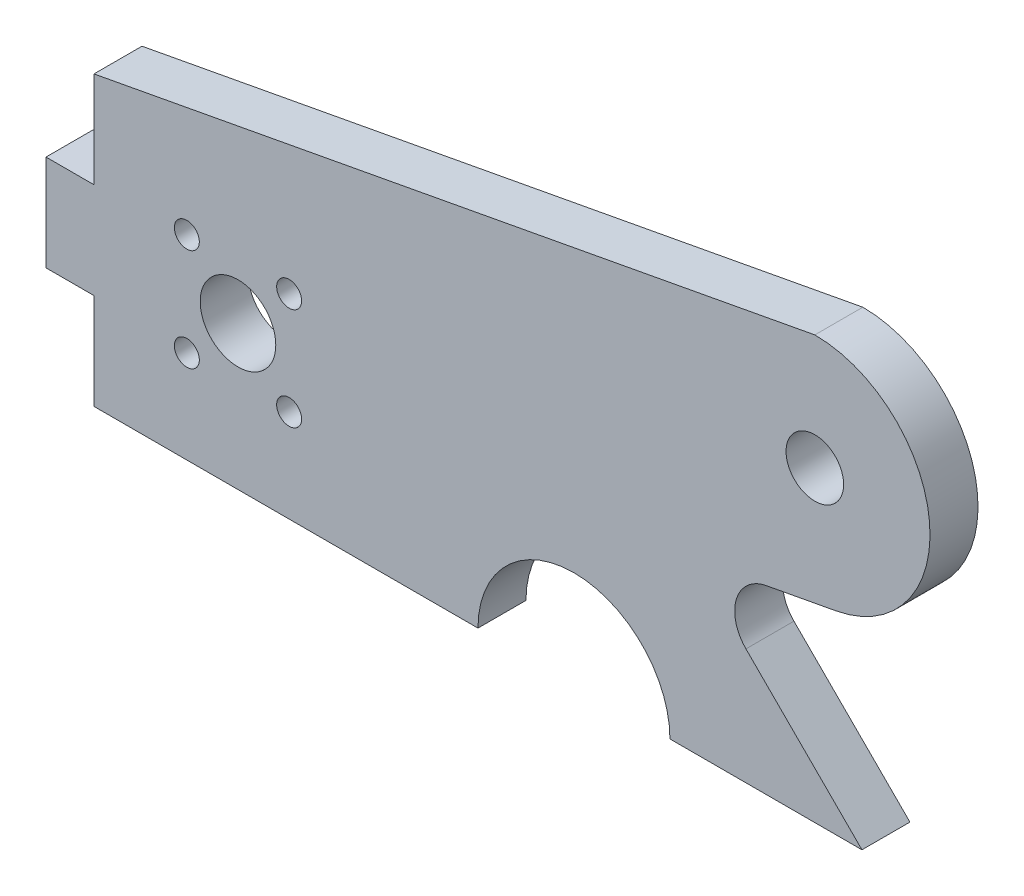
from build123d import *

# Parameters (mm, degrees)
SKETCH1_R           = 3.81
SKETCH1_R_2         = 1.651
BOSS_EXTRUDE1_DEPTH = 6.35
FILLET2_R           = 5.08
SKETCH3_R           = 1.5875
CUT_EXTRUDE1_DEPTH  = 6.35
CUT_EXTRUDE2_DEPTH  = 6.35
SKETCH7_R           = 5.000000033
CUT_EXTRUDE3_DEPTH  = 125.084268237


with BuildPart() as part:
    # Sketch1 → Boss-Extrude1 (new body)
    with BuildSketch(Plane.XY):
        with BuildLine():
            Line((0, 0), (101.6, 0))
            Line((101.6, 0), (79.43330905, 22.16669095))
            Line((79.43330905, 22.16669095), (98.16062093, 25.658150496))
            ThreePointArc((98.16062093, 25.658150496), (110.542778436, 42.04253584), (95.367453293, 55.88))
            Line((95.367453293, 55.88), (0, 38.1))
            Line((0, 38.1), (0, 25.4))
            Line((0, 25.4), (-6.35, 25.4))
            Line((-6.35, 25.4), (-6.35, 12.7))
            Line((-6.35, 12.7), (0, 12.7))
            Line((0, 12.7), (0, 0))
        make_face()
        with Locations((95.367453293, 40.64)):
            Circle(SKETCH1_R, mode=Mode.SUBTRACT)
        with Locations((25.817011896, 25.817011896)):
            Circle(SKETCH1_R_2, mode=Mode.SUBTRACT)
        with Locations((25.817011896, 12.282988104)):
            Circle(SKETCH1_R_2, mode=Mode.SUBTRACT)
        with Locations((12.282988104, 12.282988104)):
            Circle(SKETCH1_R_2, mode=Mode.SUBTRACT)
        with Locations((12.282988104, 25.817011896)):
            Circle(SKETCH1_R_2, mode=Mode.SUBTRACT)
    extrude(amount=BOSS_EXTRUDE1_DEPTH)

    # Fillet2
    fillet2_edges = [part.edges().sort_by_distance(p)[0] for p in [
        (79.43330905, 22.16669095, 3.175),
    ]]
    fillet(fillet2_edges, radius=FILLET2_R)

    # Sketch3 → Cut-Extrude1 (cut)
    with BuildSketch(Plane.ZY):
        with Locations((3.175, 31.75)):
            Circle(SKETCH3_R)
        with Locations((3.175, 6.35)):
            Circle(SKETCH3_R)
    extrude(amount=-CUT_EXTRUDE1_DEPTH, mode=Mode.SUBTRACT)

    # Sketch6 → Cut-Extrude2 (cut)
    with BuildSketch(Plane.XY.offset(6.35)):
        with BuildLine():
            Line((50.8, 0), (76.2, 0))
            ThreePointArc((76.2, 0), (63.5, 12.7), (50.8, 0))
        make_face()
    extrude(amount=-CUT_EXTRUDE2_DEPTH, mode=Mode.SUBTRACT)

    # Sketch7 → Cut-Extrude3 (cut, through all)
    with BuildSketch(Plane.XY.offset(6.35)):
        with Locations((19.05, 19.05)):
            Circle(SKETCH7_R)
    extrude(amount=-CUT_EXTRUDE3_DEPTH, mode=Mode.SUBTRACT)


solid = part.part
